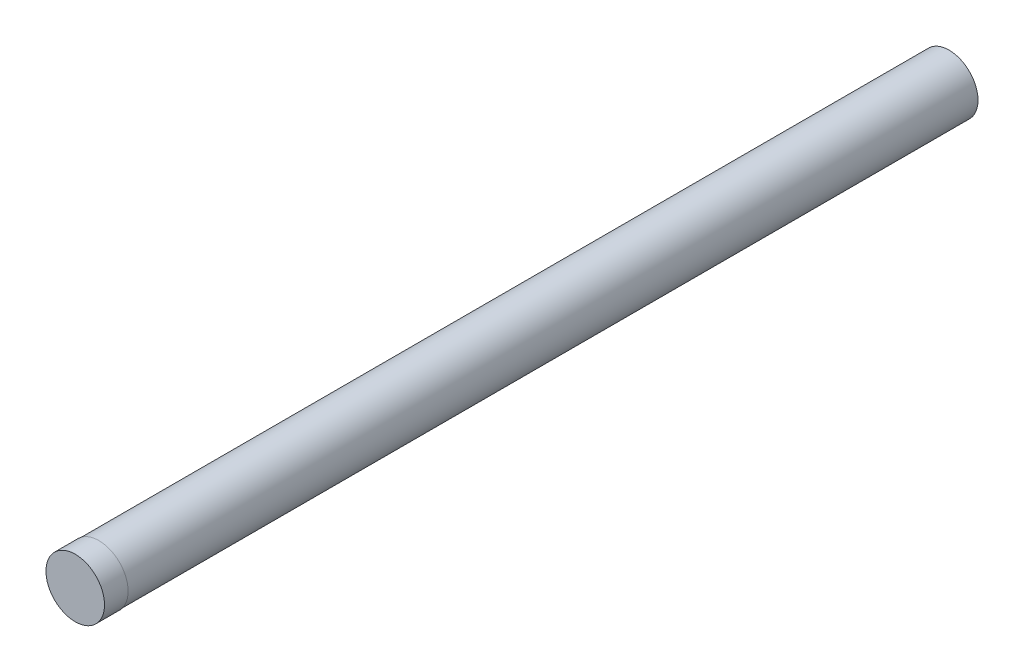
from build123d import *

# Parameters (mm, degrees)
BOSS_EXTRUDE1_DEPTH      = 10
BOSS_EXTRUDE1_DEPTH_BACK = 64
SKETCH1_R                = 2.45
SKETCH3_R                = 2.48
BOSS_EXTRUDE2_DEPTH      = 2


with BuildPart() as part:
    # Sketch1 → Boss-Extrude1 (new, two sides: drawn at the far end of the back side and taken through both)
    with BuildSketch(Plane.XY.offset(-BOSS_EXTRUDE1_DEPTH_BACK)):
        Circle(SKETCH1_R)
    extrude(amount=BOSS_EXTRUDE1_DEPTH + BOSS_EXTRUDE1_DEPTH_BACK)

    # Sketch3 → Boss-Extrude2 (add)
    with BuildSketch(Plane.XY.offset(10)):
        Circle(SKETCH3_R)
    extrude(amount=-BOSS_EXTRUDE2_DEPTH)


solid = part.part
